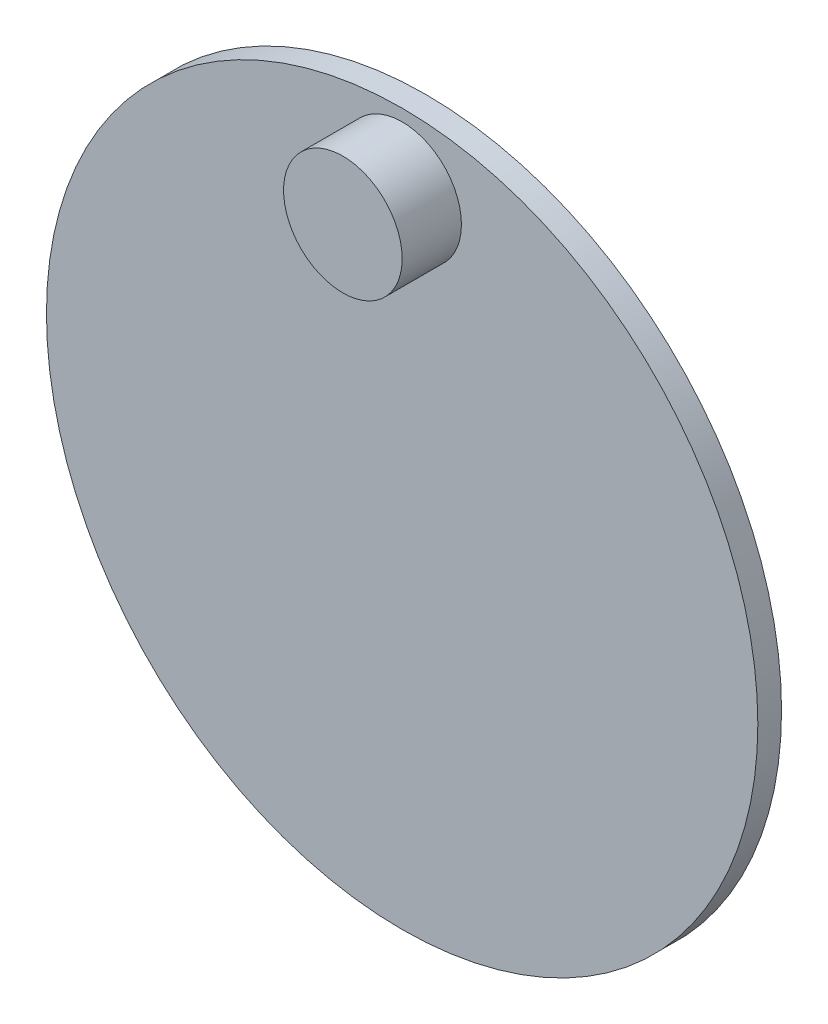
from build123d import *

# Parameters (mm, degrees)
SKETCH1_R           = 38.1
BOSS_EXTRUDE1_DEPTH = 2.54
SKETCH2_R           = 6.35
BOSS_EXTRUDE2_DEPTH = 6.35
SKETCH3_R           = 6.35
BOSS_EXTRUDE3_DEPTH = 19.05


with BuildPart() as part:
    # Sketch1 → Boss-Extrude1 (new body)
    with BuildSketch(Plane.XY):
        Circle(SKETCH1_R)
    extrude(amount=BOSS_EXTRUDE1_DEPTH)

    # Sketch2 → Boss-Extrude2 (add)
    with BuildSketch(Plane.XY.offset(2.54)):
        with Locations((0, 30.48)):
            Circle(SKETCH2_R)
    extrude(amount=BOSS_EXTRUDE2_DEPTH)

    # Sketch3 → Boss-Extrude3 (add)
    with BuildSketch(Plane(origin=(0, 0, 0), x_dir=(-1, 0, 0), z_dir=(0, 0, -1))):
        Circle(SKETCH3_R)
    extrude(amount=BOSS_EXTRUDE3_DEPTH)


solid = part.part
